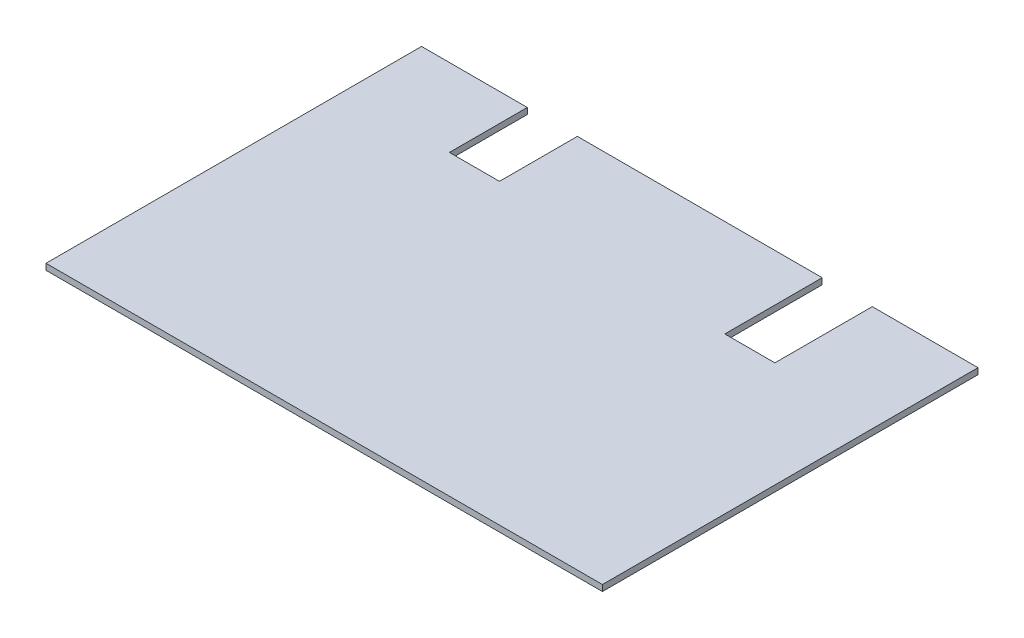
from build123d import *

# Parameters (mm, degrees)
SKETCH1_W           = 25.4
SKETCH1_H           = 17.145
BOSS_EXTRUDE1_DEPTH = 0.2794
CUT_EXTRUDE1_DEPTH  = 31.646192086


with BuildPart() as part:
    # Sketch1 → Boss-Extrude1 (new body)
    with BuildSketch(Plane(origin=(0, 0, 0), x_dir=(1, 0, 0), z_dir=(0, 1, 0))):
        with Locations((12.7, 8.5725)):
            Rectangle(SKETCH1_W, SKETCH1_H)
    extrude(amount=BOSS_EXTRUDE1_DEPTH)

    # Sketch2 → Cut-Extrude1 (cut, through all)
    with BuildSketch(Plane(origin=(0, 0.2794, 0), x_dir=(1, 0, 0), z_dir=(0, 1, 0))):
        Polygon((6.0325, 17.145), (7.112, 17.145), (7.112, 13.589), (4.826, 13.589), (4.826, 14.605), (4.826, 17.145), align=None)
        Polygon((18.288, 17.145), (19.3675, 17.145), (20.574, 17.145), (20.574, 13.589), (20.574, 12.7), (18.288, 12.7), align=None)
    extrude(amount=-CUT_EXTRUDE1_DEPTH, mode=Mode.SUBTRACT)


solid = part.part
